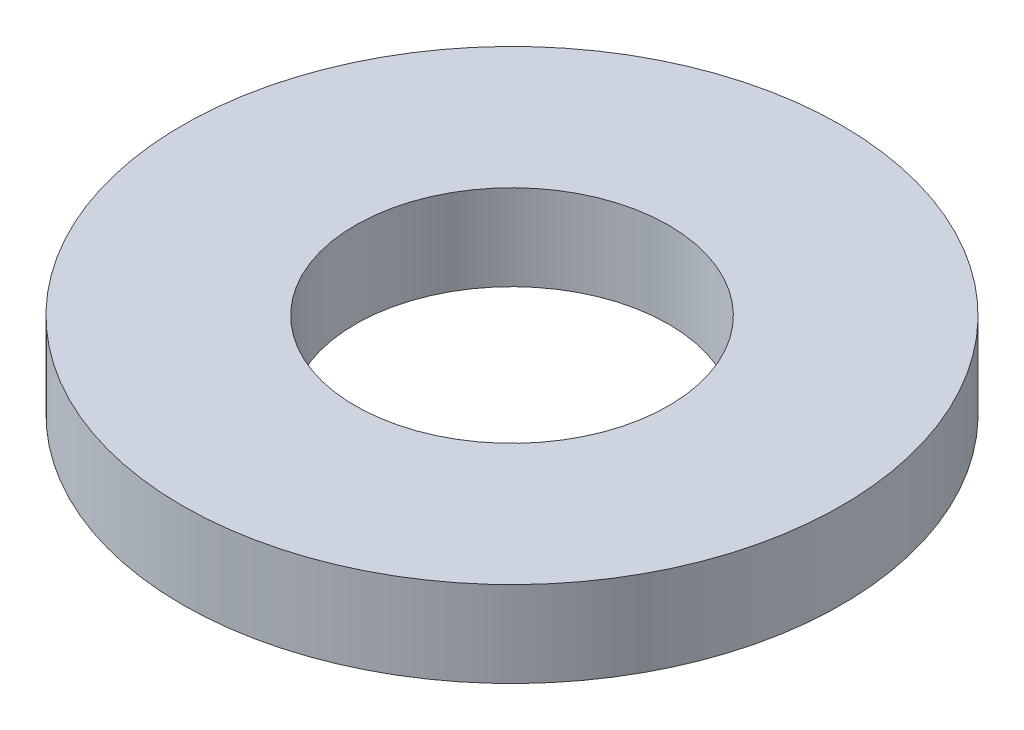
from build123d import *

# Parameters (mm, degrees)
SKETCH1_R           = 100
BOSS_EXTRUDE1_DEPTH = 26
SKETCH2_R           = 47.5
CUT_EXTRUDE1_DEPTH  = 144.791515744


with BuildPart() as part:
    # Sketch1 → Boss-Extrude1 (new body)
    with BuildSketch(Plane(origin=(0, 0, 0), x_dir=(1, 0, 0), z_dir=(0, 1, 0))):
        Circle(SKETCH1_R)
    extrude(amount=BOSS_EXTRUDE1_DEPTH)

    # Sketch2 → Cut-Extrude1 (cut, through all)
    with BuildSketch(Plane(origin=(0, 0, 0), x_dir=(1, 0, 0), z_dir=(0, 1, 0))):
        Circle(SKETCH2_R)
    extrude(amount=CUT_EXTRUDE1_DEPTH, mode=Mode.SUBTRACT)


solid = part.part
